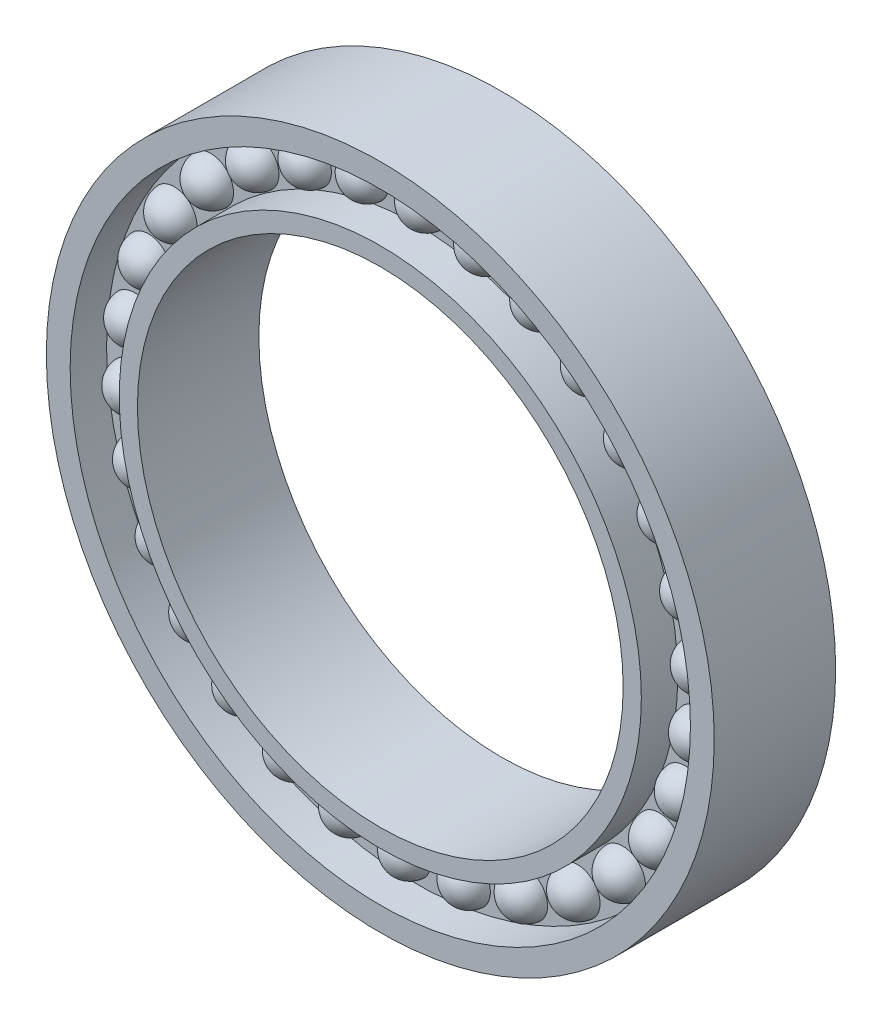
from build123d import *

# Parameters (mm, degrees)
SKETCH_1_R                       = 11
SKETCH_1_R_2                     = 8
EXTRUDE_1_DEPTH                  = 2
SKETCH_2_R                       = 10.215825938
SKETCH_2_R_2                     = 8.598967876
CUT_EXTRUDE_1_DEPTH              = 1.2
SKETCH_4_R                       = 0.75
EXTRUDE_2_DEPTH                  = 1.5
FILLET_1_R                       = 0.75
FILLET_2_R                       = 0.75
PATTERN_CIRCULAR_2_COUNT         = 30
FILLET_1_OF_PATTERN_CIRCULAR_2_R = 0.75
FILLET_2_OF_PATTERN_CIRCULAR_2_R = 0.75


with BuildPart() as part:
    # 草图1 → 凸台-拉伸1 (new, symmetric)
    with BuildSketch(Plane.XY):
        Circle(SKETCH_1_R)
        Circle(SKETCH_1_R_2, mode=Mode.SUBTRACT)
    extrude(amount=EXTRUDE_1_DEPTH, both=True)

    # 草图2 → 切除-拉伸1 (cut)
    with BuildSketch(Plane.XY.offset(2)):
        Circle(SKETCH_2_R)
        Circle(SKETCH_2_R_2, mode=Mode.SUBTRACT)
    cut_extrude_1 = extrude(amount=-CUT_EXTRUDE_1_DEPTH, mode=Mode.SUBTRACT)

    # 镜向1: 切除-拉伸1 across plane
    add(cut_extrude_1.mirror(Plane.XY), mode=Mode.SUBTRACT)

    # 草图4 → 凸台-拉伸2 (add, symmetric)
    with BuildSketch(Plane.XY):
        with Locations(Location((0.280832933, 9.38335006, 0), (0, 0, 180))):
            Circle(SKETCH_4_R)
    extrude_2 = extrude(amount=EXTRUDE_2_DEPTH, both=True)

    # 圆角1
    # the kernel refuses this fillet: 0.75 mm, written as the material it takes off along each edge
    with BuildSketch(Plane(origin=(0.280832933, 9.38335006, 1.5), x_dir=(-1, 0, 0), z_dir=(0, 1, 0))) as fillet_1_piece_1:
        with BuildLine():
            CenterArc((0.001668523, -0.75), FILLET_1_R, 3.822553729, 86.177446271)
            Line((0.001668523, 0), (0.001668523, 0.015))
            Line((0.001668523, 0.015), (0.75, 0.015))
            Line((0.75, 0.015), (0.765, 0))
            ThreePointArc((0.765, 0), (0.765, -0.35), (0.76496663, -0.699))
            Line((0.76496663, -0.699), (0.75, -0.7))
        make_face()
    revolve(axis=Axis((0.280832933, 9.38335006, 1.5), (0, 0, 1)), mode=Mode.SUBTRACT)

    # 圆角2
    # the kernel refuses this fillet: 0.75 mm, written as the material it takes off along each edge
    with BuildSketch(Plane(origin=(0.280832933, 9.38335006, -1.5), x_dir=(-1, 0, 0), z_dir=(0, 1, 0))) as fillet_2_piece_1:
        with BuildLine():
            CenterArc((0.001668523, 0.75), FILLET_2_R, 270, 86.177446271)
            Line((0.001668523, 0), (0.001668523, -0.015))
            Line((0.001668523, -0.015), (0.75, -0.015))
            Line((0.75, -0.015), (0.765, 0))
            ThreePointArc((0.765, 0), (0.765, 0.35), (0.76496663, 0.699))
            Line((0.76496663, 0.699), (0.75, 0.7))
        make_face()
    revolve(axis=Axis((0.280832933, 9.38335006, -1.5), (0, 0, 1)), mode=Mode.SUBTRACT)

    # 阵列(圆周)2: 凸台-拉伸2 ×30 about axis
    pattern_circular_2_axis = Axis((0, 0, 0), (0, 0, 1))
    for i in range(1, PATTERN_CIRCULAR_2_COUNT):
        add(extrude_2.rotate(pattern_circular_2_axis, i * 360 / PATTERN_CIRCULAR_2_COUNT))

    # 圆角1 of 阵列(圆周)2
    # the kernel refuses this fillet: 0.75 mm, written as the material it takes off along each edge
    with BuildSketch(Plane(origin=(-1.676212117, 9.236689798, 1.5), x_dir=(-0.9781476007338056, -0.2079116908177596, 0), z_dir=(-0.2079116908177596, 0.9781476007338056, 0))) as fillet_1_of_pattern_circular_2_piece_1:
        with BuildLine():
            CenterArc((0.001668523, -0.75), FILLET_1_OF_PATTERN_CIRCULAR_2_R, 3.822553729, 86.177446271)
            Line((0.001668523, 0), (0.001668523, 0.015))
            Line((0.001668523, 0.015), (0.75, 0.015))
            Line((0.75, 0.015), (0.765, 0))
            ThreePointArc((0.765, 0), (0.765, -0.35), (0.76496663, -0.699))
            Line((0.76496663, -0.699), (0.75, -0.7))
        make_face()
    revolve(axis=Axis((-1.676212117, 9.236689798, 1.5), (0, 0, 1)), mode=Mode.SUBTRACT)
    with BuildSketch(Plane(origin=(-3.559998654, 8.68634187, 1.5), x_dir=(-0.9135454576426008, -0.4067366430758004, 0), z_dir=(-0.4067366430758004, 0.9135454576426008, 0))) as fillet_1_of_pattern_circular_2_piece_2:
        with BuildLine():
            CenterArc((0.001668523, -0.75), FILLET_1_OF_PATTERN_CIRCULAR_2_R, 3.822553729, 86.177446271)
            Line((0.001668523, 0), (0.001668523, 0.015))
            Line((0.001668523, 0.015), (0.75, 0.015))
            Line((0.75, 0.015), (0.765, 0))
            ThreePointArc((0.765, 0), (0.765, -0.35), (0.76496663, -0.699))
            Line((0.76496663, -0.699), (0.75, -0.7))
        make_face()
    revolve(axis=Axis((-3.559998654, 8.68634187, 1.5), (0, 0, 1)), mode=Mode.SUBTRACT)
    with BuildSketch(Plane(origin=(-5.288196167, 7.75635912, 1.5), x_dir=(-0.8090169943749473, -0.5877852522924731, 0), z_dir=(-0.5877852522924731, 0.8090169943749473, 0))) as fillet_1_of_pattern_circular_2_piece_3:
        with BuildLine():
            CenterArc((0.001668523, -0.75), FILLET_1_OF_PATTERN_CIRCULAR_2_R, 3.822553729, 86.177446271)
            Line((0.001668523, 0), (0.001668523, 0.015))
            Line((0.001668523, 0.015), (0.75, 0.015))
            Line((0.75, 0.015), (0.765, 0))
            ThreePointArc((0.765, 0), (0.765, -0.35), (0.76496663, -0.699))
            Line((0.76496663, -0.699), (0.75, -0.7))
        make_face()
    revolve(axis=Axis((-5.288196167, 7.75635912, 1.5), (0, 0, 1)), mode=Mode.SUBTRACT)
    with BuildSketch(Plane(origin=(-6.785274132, 6.487386257, 1.5), x_dir=(-0.6691306063588576, -0.7431448254773948, 0), z_dir=(-0.7431448254773948, 0.6691306063588576, 0))) as fillet_1_of_pattern_circular_2_piece_4:
        with BuildLine():
            CenterArc((0.001668523, -0.75), FILLET_1_OF_PATTERN_CIRCULAR_2_R, 3.822553729, 86.177446271)
            Line((0.001668523, 0), (0.001668523, 0.015))
            Line((0.001668523, 0.015), (0.75, 0.015))
            Line((0.75, 0.015), (0.765, 0))
            ThreePointArc((0.765, 0), (0.765, -0.35), (0.76496663, -0.699))
            Line((0.76496663, -0.699), (0.75, -0.7))
        make_face()
    revolve(axis=Axis((-6.785274132, 6.487386257, 1.5), (0, 0, 1)), mode=Mode.SUBTRACT)
    with BuildSketch(Plane(origin=(-7.985803058, 4.934883485, 1.5), x_dir=(-0.4999999999999991, -0.8660254037844392, 0), z_dir=(-0.8660254037844392, 0.4999999999999991, 0))) as fillet_1_of_pattern_circular_2_piece_5:
        with BuildLine():
            CenterArc((0.001668523, -0.75), FILLET_1_OF_PATTERN_CIRCULAR_2_R, 3.822553729, 86.177446271)
            Line((0.001668523, 0), (0.001668523, 0.015))
            Line((0.001668523, 0.015), (0.75, 0.015))
            Line((0.75, 0.015), (0.765, 0))
            ThreePointArc((0.765, 0), (0.765, -0.35), (0.76496663, -0.699))
            Line((0.76496663, -0.699), (0.75, -0.7))
        make_face()
    revolve(axis=Axis((-7.985803058, 4.934883485, 1.5), (0, 0, 1)), mode=Mode.SUBTRACT)
    with BuildSketch(Plane(origin=(-8.837314071, 3.166702624, 1.5), x_dir=(-0.3090169943749475, -0.9510565162951535, 0), z_dir=(-0.9510565162951535, 0.3090169943749475, 0))) as fillet_1_of_pattern_circular_2_piece_6:
        with BuildLine():
            CenterArc((0.001668523, -0.75), FILLET_1_OF_PATTERN_CIRCULAR_2_R, 3.822553729, 86.177446271)
            Line((0.001668523, 0), (0.001668523, 0.015))
            Line((0.001668523, 0.015), (0.75, 0.015))
            Line((0.75, 0.015), (0.765, 0))
            ThreePointArc((0.765, 0), (0.765, -0.35), (0.76496663, -0.699))
            Line((0.76496663, -0.699), (0.75, -0.7))
        make_face()
    revolve(axis=Axis((-8.837314071, 3.166702624, 1.5), (0, 0, 1)), mode=Mode.SUBTRACT)
    with BuildSketch(Plane(origin=(-9.302592052, 1.260121663, 1.5), x_dir=(-0.10452846326765315, -0.9945218953682734, 0), z_dir=(-0.9945218953682734, 0.10452846326765315, 0))) as fillet_1_of_pattern_circular_2_piece_7:
        with BuildLine():
            CenterArc((0.001668523, -0.75), FILLET_1_OF_PATTERN_CIRCULAR_2_R, 3.822553729, 86.177446271)
            Line((0.001668523, 0), (0.001668523, 0.015))
            Line((0.001668523, 0.015), (0.75, 0.015))
            Line((0.75, 0.015), (0.765, 0))
            ThreePointArc((0.765, 0), (0.765, -0.35), (0.76496663, -0.699))
            Line((0.76496663, -0.699), (0.75, -0.7))
        make_face()
    revolve(axis=Axis((-9.302592052, 1.260121663, 1.5), (0, 0, 1)), mode=Mode.SUBTRACT)
    with BuildSketch(Plane(origin=(-9.361302122, -0.701532661, 1.5), x_dir=(0.10452846326765314, -0.9945218953682734, 0), z_dir=(-0.9945218953682734, -0.10452846326765314, 0))) as fillet_1_of_pattern_circular_2_piece_8:
        with BuildLine():
            CenterArc((0.001668523, -0.75), FILLET_1_OF_PATTERN_CIRCULAR_2_R, 3.822553729, 86.177446271)
            Line((0.001668523, 0), (0.001668523, 0.015))
            Line((0.001668523, 0.015), (0.75, 0.015))
            Line((0.75, 0.015), (0.765, 0))
            ThreePointArc((0.765, 0), (0.765, -0.35), (0.76496663, -0.699))
            Line((0.76496663, -0.699), (0.75, -0.7))
        make_face()
    revolve(axis=Axis((-9.361302122, -0.701532661, 1.5), (0, 0, 1)), mode=Mode.SUBTRACT)
    with BuildSketch(Plane(origin=(-9.010878369, -2.632526642, 1.5), x_dir=(0.3090169943749475, -0.9510565162951535, 0), z_dir=(-0.9510565162951535, -0.3090169943749475, 0))) as fillet_1_of_pattern_circular_2_piece_9:
        with BuildLine():
            CenterArc((0.001668523, -0.75), FILLET_1_OF_PATTERN_CIRCULAR_2_R, 3.822553729, 86.177446271)
            Line((0.001668523, 0), (0.001668523, 0.015))
            Line((0.001668523, 0.015), (0.75, 0.015))
            Line((0.75, 0.015), (0.765, 0))
            ThreePointArc((0.765, 0), (0.765, -0.35), (0.76496663, -0.699))
            Line((0.76496663, -0.699), (0.75, -0.7))
        make_face()
    revolve(axis=Axis((-9.010878369, -2.632526642, 1.5), (0, 0, 1)), mode=Mode.SUBTRACT)
    with BuildSketch(Plane(origin=(-8.266635992, -4.448466576, 1.5), x_dir=(0.5, -0.8660254037844387, 0), z_dir=(-0.8660254037844387, -0.5, 0))) as fillet_1_of_pattern_circular_2_piece_10:
        with BuildLine():
            CenterArc((0.001668523, -0.75), FILLET_1_OF_PATTERN_CIRCULAR_2_R, 3.822553729, 86.177446271)
            Line((0.001668523, 0), (0.001668523, 0.015))
            Line((0.001668523, 0.015), (0.75, 0.015))
            Line((0.75, 0.015), (0.765, 0))
            ThreePointArc((0.765, 0), (0.765, -0.35), (0.76496663, -0.699))
            Line((0.76496663, -0.699), (0.75, -0.7))
        make_face()
    revolve(axis=Axis((-8.266635992, -4.448466576, 1.5), (0, 0, 1)), mode=Mode.SUBTRACT)
    with BuildSketch(Plane(origin=(-7.161101954, -6.069987174, 1.5), x_dir=(0.6691306063588576, -0.7431448254773948, 0), z_dir=(-0.7431448254773948, -0.6691306063588576, 0))) as fillet_1_of_pattern_circular_2_piece_11:
        with BuildLine():
            CenterArc((0.001668523, -0.75), FILLET_1_OF_PATTERN_CIRCULAR_2_R, 3.822553729, 86.177446271)
            Line((0.001668523, 0), (0.001668523, 0.015))
            Line((0.001668523, 0.015), (0.75, 0.015))
            Line((0.75, 0.015), (0.765, 0))
            ThreePointArc((0.765, 0), (0.765, -0.35), (0.76496663, -0.699))
            Line((0.76496663, -0.699), (0.75, -0.7))
        make_face()
    revolve(axis=Axis((-7.161101954, -6.069987174, 1.5), (0, 0, 1)), mode=Mode.SUBTRACT)
    with BuildSketch(Plane(origin=(-5.742593398, -7.426220206, 1.5), x_dir=(0.8090169943749473, -0.5877852522924731, 0), z_dir=(-0.5877852522924731, -0.8090169943749473, 0))) as fillet_1_of_pattern_circular_2_piece_12:
        with BuildLine():
            CenterArc((0.001668523, -0.75), FILLET_1_OF_PATTERN_CIRCULAR_2_R, 3.822553729, 86.177446271)
            Line((0.001668523, 0), (0.001668523, 0.015))
            Line((0.001668523, 0.015), (0.75, 0.015))
            Line((0.75, 0.015), (0.765, 0))
            ThreePointArc((0.765, 0), (0.765, -0.35), (0.76496663, -0.699))
            Line((0.76496663, -0.699), (0.75, -0.7))
        make_face()
    revolve(axis=Axis((-5.742593398, -7.426220206, 1.5), (0, 0, 1)), mode=Mode.SUBTRACT)
    with BuildSketch(Plane(origin=(-4.073105955, -8.457891781, 1.5), x_dir=(0.9135454576426008, -0.40673664307580065, 0), z_dir=(-0.40673664307580065, -0.9135454576426008, 0))) as fillet_1_of_pattern_circular_2_piece_13:
        with BuildLine():
            CenterArc((0.001668523, -0.75), FILLET_1_OF_PATTERN_CIRCULAR_2_R, 3.822553729, 86.177446271)
            Line((0.001668523, 0), (0.001668523, 0.015))
            Line((0.001668523, 0.015), (0.75, 0.015))
            Line((0.75, 0.015), (0.765, 0))
            ThreePointArc((0.765, 0), (0.765, -0.35), (0.76496663, -0.699))
            Line((0.76496663, -0.699), (0.75, -0.7))
        make_face()
    revolve(axis=Axis((-4.073105955, -8.457891781, 1.5), (0, 0, 1)), mode=Mode.SUBTRACT)
    with BuildSketch(Plane(origin=(-2.225604236, -9.119912898, 1.5), x_dir=(0.9781476007338056, -0.20791169081775945, 0), z_dir=(-0.20791169081775945, -0.9781476007338056, 0))) as fillet_1_of_pattern_circular_2_piece_14:
        with BuildLine():
            CenterArc((0.001668523, -0.75), FILLET_1_OF_PATTERN_CIRCULAR_2_R, 3.822553729, 86.177446271)
            Line((0.001668523, 0), (0.001668523, 0.015))
            Line((0.001668523, 0.015), (0.75, 0.015))
            Line((0.75, 0.015), (0.765, 0))
            ThreePointArc((0.765, 0), (0.765, -0.35), (0.76496663, -0.699))
            Line((0.76496663, -0.699), (0.75, -0.7))
        make_face()
    revolve(axis=Axis((-2.225604236, -9.119912898, 1.5), (0, 0, 1)), mode=Mode.SUBTRACT)
    with BuildSketch(Plane(origin=(-0.280832933, -9.38335006, 1.5), x_dir=(1, 0, 0), z_dir=(0, -1, 0))) as fillet_1_of_pattern_circular_2_piece_15:
        with BuildLine():
            CenterArc((0.001668523, -0.75), FILLET_1_OF_PATTERN_CIRCULAR_2_R, 3.822553729, 86.177446271)
            Line((0.001668523, 0), (0.001668523, 0.015))
            Line((0.001668523, 0.015), (0.75, 0.015))
            Line((0.75, 0.015), (0.765, 0))
            ThreePointArc((0.765, 0), (0.765, -0.35), (0.76496663, -0.699))
            Line((0.76496663, -0.699), (0.75, -0.7))
        make_face()
    revolve(axis=Axis((-0.280832933, -9.38335006, 1.5), (0, 0, 1)), mode=Mode.SUBTRACT)
    with BuildSketch(Plane(origin=(1.676212117, -9.236689798, 1.5), x_dir=(0.9781476007338056, 0.2079116908177596, 0), z_dir=(0.2079116908177596, -0.9781476007338056, 0))) as fillet_1_of_pattern_circular_2_piece_16:
        with BuildLine():
            CenterArc((0.001668523, -0.75), FILLET_1_OF_PATTERN_CIRCULAR_2_R, 3.822553729, 86.177446271)
            Line((0.001668523, 0), (0.001668523, 0.015))
            Line((0.001668523, 0.015), (0.75, 0.015))
            Line((0.75, 0.015), (0.765, 0))
            ThreePointArc((0.765, 0), (0.765, -0.35), (0.76496663, -0.699))
            Line((0.76496663, -0.699), (0.75, -0.7))
        make_face()
    revolve(axis=Axis((1.676212117, -9.236689798, 1.5), (0, 0, 1)), mode=Mode.SUBTRACT)
    with BuildSketch(Plane(origin=(3.559998654, -8.68634187, 1.5), x_dir=(0.9135454576426008, 0.4067366430758004, 0), z_dir=(0.4067366430758004, -0.9135454576426008, 0))) as fillet_1_of_pattern_circular_2_piece_17:
        with BuildLine():
            CenterArc((0.001668523, -0.75), FILLET_1_OF_PATTERN_CIRCULAR_2_R, 3.822553729, 86.177446271)
            Line((0.001668523, 0), (0.001668523, 0.015))
            Line((0.001668523, 0.015), (0.75, 0.015))
            Line((0.75, 0.015), (0.765, 0))
            ThreePointArc((0.765, 0), (0.765, -0.35), (0.76496663, -0.699))
            Line((0.76496663, -0.699), (0.75, -0.7))
        make_face()
    revolve(axis=Axis((3.559998654, -8.68634187, 1.5), (0, 0, 1)), mode=Mode.SUBTRACT)
    with BuildSketch(Plane(origin=(5.288196167, -7.75635912, 1.5), x_dir=(0.8090169943749473, 0.5877852522924731, 0), z_dir=(0.5877852522924731, -0.8090169943749473, 0))) as fillet_1_of_pattern_circular_2_piece_18:
        with BuildLine():
            CenterArc((0.001668523, -0.75), FILLET_1_OF_PATTERN_CIRCULAR_2_R, 3.822553729, 86.177446271)
            Line((0.001668523, 0), (0.001668523, 0.015))
            Line((0.001668523, 0.015), (0.75, 0.015))
            Line((0.75, 0.015), (0.765, 0))
            ThreePointArc((0.765, 0), (0.765, -0.35), (0.76496663, -0.699))
            Line((0.76496663, -0.699), (0.75, -0.7))
        make_face()
    revolve(axis=Axis((5.288196167, -7.75635912, 1.5), (0, 0, 1)), mode=Mode.SUBTRACT)
    with BuildSketch(Plane(origin=(6.785274132, -6.487386257, 1.5), x_dir=(0.6691306063588576, 0.7431448254773948, 0), z_dir=(0.7431448254773948, -0.6691306063588576, 0))) as fillet_1_of_pattern_circular_2_piece_19:
        with BuildLine():
            CenterArc((0.001668523, -0.75), FILLET_1_OF_PATTERN_CIRCULAR_2_R, 3.822553729, 86.177446271)
            Line((0.001668523, 0), (0.001668523, 0.015))
            Line((0.001668523, 0.015), (0.75, 0.015))
            Line((0.75, 0.015), (0.765, 0))
            ThreePointArc((0.765, 0), (0.765, -0.35), (0.76496663, -0.699))
            Line((0.76496663, -0.699), (0.75, -0.7))
        make_face()
    revolve(axis=Axis((6.785274132, -6.487386257, 1.5), (0, 0, 1)), mode=Mode.SUBTRACT)
    with BuildSketch(Plane(origin=(7.985803058, -4.934883485, 1.5), x_dir=(0.5, 0.8660254037844387, 0), z_dir=(0.8660254037844387, -0.5, 0))) as fillet_1_of_pattern_circular_2_piece_20:
        with BuildLine():
            CenterArc((0.001668523, -0.75), FILLET_1_OF_PATTERN_CIRCULAR_2_R, 3.822553729, 86.177446271)
            Line((0.001668523, 0), (0.001668523, 0.015))
            Line((0.001668523, 0.015), (0.75, 0.015))
            Line((0.75, 0.015), (0.765, 0))
            ThreePointArc((0.765, 0), (0.765, -0.35), (0.76496663, -0.699))
            Line((0.76496663, -0.699), (0.75, -0.7))
        make_face()
    revolve(axis=Axis((7.985803058, -4.934883485, 1.5), (0, 0, 1)), mode=Mode.SUBTRACT)
    with BuildSketch(Plane(origin=(8.837314071, -3.166702624, 1.5), x_dir=(0.3090169943749475, 0.9510565162951535, 0), z_dir=(0.9510565162951535, -0.3090169943749475, 0))) as fillet_1_of_pattern_circular_2_piece_21:
        with BuildLine():
            CenterArc((0.001668523, -0.75), FILLET_1_OF_PATTERN_CIRCULAR_2_R, 3.822553729, 86.177446271)
            Line((0.001668523, 0), (0.001668523, 0.015))
            Line((0.001668523, 0.015), (0.75, 0.015))
            Line((0.75, 0.015), (0.765, 0))
            ThreePointArc((0.765, 0), (0.765, -0.35), (0.76496663, -0.699))
            Line((0.76496663, -0.699), (0.75, -0.7))
        make_face()
    revolve(axis=Axis((8.837314071, -3.166702624, 1.5), (0, 0, 1)), mode=Mode.SUBTRACT)
    with BuildSketch(Plane(origin=(9.302592052, -1.260121663, 1.5), x_dir=(0.10452846326765314, 0.9945218953682734, 0), z_dir=(0.9945218953682734, -0.10452846326765314, 0))) as fillet_1_of_pattern_circular_2_piece_22:
        with BuildLine():
            CenterArc((0.001668523, -0.75), FILLET_1_OF_PATTERN_CIRCULAR_2_R, 3.822553729, 86.177446271)
            Line((0.001668523, 0), (0.001668523, 0.015))
            Line((0.001668523, 0.015), (0.75, 0.015))
            Line((0.75, 0.015), (0.765, 0))
            ThreePointArc((0.765, 0), (0.765, -0.35), (0.76496663, -0.699))
            Line((0.76496663, -0.699), (0.75, -0.7))
        make_face()
    revolve(axis=Axis((9.302592052, -1.260121663, 1.5), (0, 0, 1)), mode=Mode.SUBTRACT)
    with BuildSketch(Plane(origin=(9.361302122, 0.701532661, 1.5), x_dir=(-0.10452846326765314, 0.9945218953682734, 0), z_dir=(0.9945218953682734, 0.10452846326765314, 0))) as fillet_1_of_pattern_circular_2_piece_23:
        with BuildLine():
            CenterArc((0.001668523, -0.75), FILLET_1_OF_PATTERN_CIRCULAR_2_R, 3.822553729, 86.177446271)
            Line((0.001668523, 0), (0.001668523, 0.015))
            Line((0.001668523, 0.015), (0.75, 0.015))
            Line((0.75, 0.015), (0.765, 0))
            ThreePointArc((0.765, 0), (0.765, -0.35), (0.76496663, -0.699))
            Line((0.76496663, -0.699), (0.75, -0.7))
        make_face()
    revolve(axis=Axis((9.361302122, 0.701532661, 1.5), (0, 0, 1)), mode=Mode.SUBTRACT)
    with BuildSketch(Plane(origin=(9.010878369, 2.632526642, 1.5), x_dir=(-0.3090169943749475, 0.9510565162951535, 0), z_dir=(0.9510565162951535, 0.3090169943749475, 0))) as fillet_1_of_pattern_circular_2_piece_24:
        with BuildLine():
            CenterArc((0.001668523, -0.75), FILLET_1_OF_PATTERN_CIRCULAR_2_R, 3.822553729, 86.177446271)
            Line((0.001668523, 0), (0.001668523, 0.015))
            Line((0.001668523, 0.015), (0.75, 0.015))
            Line((0.75, 0.015), (0.765, 0))
            ThreePointArc((0.765, 0), (0.765, -0.35), (0.76496663, -0.699))
            Line((0.76496663, -0.699), (0.75, -0.7))
        make_face()
    revolve(axis=Axis((9.010878369, 2.632526642, 1.5), (0, 0, 1)), mode=Mode.SUBTRACT)
    with BuildSketch(Plane(origin=(8.266635992, 4.448466576, 1.5), x_dir=(-0.5000000000000009, 0.8660254037844382, 0), z_dir=(0.8660254037844382, 0.5000000000000009, 0))) as fillet_1_of_pattern_circular_2_piece_25:
        with BuildLine():
            CenterArc((0.001668523, -0.75), FILLET_1_OF_PATTERN_CIRCULAR_2_R, 3.822553729, 86.177446271)
            Line((0.001668523, 0), (0.001668523, 0.015))
            Line((0.001668523, 0.015), (0.75, 0.015))
            Line((0.75, 0.015), (0.765, 0))
            ThreePointArc((0.765, 0), (0.765, -0.35), (0.76496663, -0.699))
            Line((0.76496663, -0.699), (0.75, -0.7))
        make_face()
    revolve(axis=Axis((8.266635992, 4.448466576, 1.5), (0, 0, 1)), mode=Mode.SUBTRACT)
    with BuildSketch(Plane(origin=(7.161101954, 6.069987174, 1.5), x_dir=(-0.6691306063588576, 0.7431448254773948, 0), z_dir=(0.7431448254773948, 0.6691306063588576, 0))) as fillet_1_of_pattern_circular_2_piece_26:
        with BuildLine():
            CenterArc((0.001668523, -0.75), FILLET_1_OF_PATTERN_CIRCULAR_2_R, 3.822553729, 86.177446271)
            Line((0.001668523, 0), (0.001668523, 0.015))
            Line((0.001668523, 0.015), (0.75, 0.015))
            Line((0.75, 0.015), (0.765, 0))
            ThreePointArc((0.765, 0), (0.765, -0.35), (0.76496663, -0.699))
            Line((0.76496663, -0.699), (0.75, -0.7))
        make_face()
    revolve(axis=Axis((7.161101954, 6.069987174, 1.5), (0, 0, 1)), mode=Mode.SUBTRACT)
    with BuildSketch(Plane(origin=(5.742593398, 7.426220206, 1.5), x_dir=(-0.8090169943749473, 0.5877852522924731, 0), z_dir=(0.5877852522924731, 0.8090169943749473, 0))) as fillet_1_of_pattern_circular_2_piece_27:
        with BuildLine():
            CenterArc((0.001668523, -0.75), FILLET_1_OF_PATTERN_CIRCULAR_2_R, 3.822553729, 86.177446271)
            Line((0.001668523, 0), (0.001668523, 0.015))
            Line((0.001668523, 0.015), (0.75, 0.015))
            Line((0.75, 0.015), (0.765, 0))
            ThreePointArc((0.765, 0), (0.765, -0.35), (0.76496663, -0.699))
            Line((0.76496663, -0.699), (0.75, -0.7))
        make_face()
    revolve(axis=Axis((5.742593398, 7.426220206, 1.5), (0, 0, 1)), mode=Mode.SUBTRACT)
    with BuildSketch(Plane(origin=(4.073105955, 8.457891781, 1.5), x_dir=(-0.913545457642601, 0.4067366430758002, 0), z_dir=(0.4067366430758002, 0.913545457642601, 0))) as fillet_1_of_pattern_circular_2_piece_28:
        with BuildLine():
            CenterArc((0.001668523, -0.75), FILLET_1_OF_PATTERN_CIRCULAR_2_R, 3.822553729, 86.177446271)
            Line((0.001668523, 0), (0.001668523, 0.015))
            Line((0.001668523, 0.015), (0.75, 0.015))
            Line((0.75, 0.015), (0.765, 0))
            ThreePointArc((0.765, 0), (0.765, -0.35), (0.76496663, -0.699))
            Line((0.76496663, -0.699), (0.75, -0.7))
        make_face()
    revolve(axis=Axis((4.073105955, 8.457891781, 1.5), (0, 0, 1)), mode=Mode.SUBTRACT)
    with BuildSketch(Plane(origin=(2.225604236, 9.119912898, 1.5), x_dir=(-0.9781476007338056, 0.20791169081775954, 0), z_dir=(0.20791169081775954, 0.9781476007338056, 0))) as fillet_1_of_pattern_circular_2_piece_29:
        with BuildLine():
            CenterArc((0.001668523, -0.75), FILLET_1_OF_PATTERN_CIRCULAR_2_R, 3.822553729, 86.177446271)
            Line((0.001668523, 0), (0.001668523, 0.015))
            Line((0.001668523, 0.015), (0.75, 0.015))
            Line((0.75, 0.015), (0.765, 0))
            ThreePointArc((0.765, 0), (0.765, -0.35), (0.76496663, -0.699))
            Line((0.76496663, -0.699), (0.75, -0.7))
        make_face()
    revolve(axis=Axis((2.225604236, 9.119912898, 1.5), (0, 0, 1)), mode=Mode.SUBTRACT)

    # 圆角2 of 阵列(圆周)2
    # the kernel refuses this fillet: 0.75 mm, written as the material it takes off along each edge
    with BuildSketch(Plane(origin=(-1.676212117, 9.236689798, -1.5), x_dir=(-0.9781476007338056, -0.2079116908177596, 0), z_dir=(-0.2079116908177596, 0.9781476007338056, 0))) as fillet_2_of_pattern_circular_2_piece_1:
        with BuildLine():
            CenterArc((0.001668523, 0.75), FILLET_2_OF_PATTERN_CIRCULAR_2_R, 270, 86.177446271)
            Line((0.001668523, 0), (0.001668523, -0.015))
            Line((0.001668523, -0.015), (0.75, -0.015))
            Line((0.75, -0.015), (0.765, 0))
            ThreePointArc((0.765, 0), (0.765, 0.35), (0.76496663, 0.699))
            Line((0.76496663, 0.699), (0.75, 0.7))
        make_face()
    revolve(axis=Axis((-1.676212117, 9.236689798, -1.5), (0, 0, 1)), mode=Mode.SUBTRACT)
    with BuildSketch(Plane(origin=(-3.559998654, 8.68634187, -1.5), x_dir=(-0.9135454576426008, -0.4067366430758004, 0), z_dir=(-0.4067366430758004, 0.9135454576426008, 0))) as fillet_2_of_pattern_circular_2_piece_2:
        with BuildLine():
            CenterArc((0.001668523, 0.75), FILLET_2_OF_PATTERN_CIRCULAR_2_R, 270, 86.177446271)
            Line((0.001668523, 0), (0.001668523, -0.015))
            Line((0.001668523, -0.015), (0.75, -0.015))
            Line((0.75, -0.015), (0.765, 0))
            ThreePointArc((0.765, 0), (0.765, 0.35), (0.76496663, 0.699))
            Line((0.76496663, 0.699), (0.75, 0.7))
        make_face()
    revolve(axis=Axis((-3.559998654, 8.68634187, -1.5), (0, 0, 1)), mode=Mode.SUBTRACT)
    with BuildSketch(Plane(origin=(-5.288196167, 7.75635912, -1.5), x_dir=(-0.8090169943749473, -0.5877852522924731, 0), z_dir=(-0.5877852522924731, 0.8090169943749473, 0))) as fillet_2_of_pattern_circular_2_piece_3:
        with BuildLine():
            CenterArc((0.001668523, 0.75), FILLET_2_OF_PATTERN_CIRCULAR_2_R, 270, 86.177446271)
            Line((0.001668523, 0), (0.001668523, -0.015))
            Line((0.001668523, -0.015), (0.75, -0.015))
            Line((0.75, -0.015), (0.765, 0))
            ThreePointArc((0.765, 0), (0.765, 0.35), (0.76496663, 0.699))
            Line((0.76496663, 0.699), (0.75, 0.7))
        make_face()
    revolve(axis=Axis((-5.288196167, 7.75635912, -1.5), (0, 0, 1)), mode=Mode.SUBTRACT)
    with BuildSketch(Plane(origin=(-6.785274132, 6.487386257, -1.5), x_dir=(-0.6691306063588576, -0.7431448254773948, 0), z_dir=(-0.7431448254773948, 0.6691306063588576, 0))) as fillet_2_of_pattern_circular_2_piece_4:
        with BuildLine():
            CenterArc((0.001668523, 0.75), FILLET_2_OF_PATTERN_CIRCULAR_2_R, 270, 86.177446271)
            Line((0.001668523, 0), (0.001668523, -0.015))
            Line((0.001668523, -0.015), (0.75, -0.015))
            Line((0.75, -0.015), (0.765, 0))
            ThreePointArc((0.765, 0), (0.765, 0.35), (0.76496663, 0.699))
            Line((0.76496663, 0.699), (0.75, 0.7))
        make_face()
    revolve(axis=Axis((-6.785274132, 6.487386257, -1.5), (0, 0, 1)), mode=Mode.SUBTRACT)
    with BuildSketch(Plane(origin=(-7.985803058, 4.934883485, -1.5), x_dir=(-0.4999999999999991, -0.8660254037844392, 0), z_dir=(-0.8660254037844392, 0.4999999999999991, 0))) as fillet_2_of_pattern_circular_2_piece_5:
        with BuildLine():
            CenterArc((0.001668523, 0.75), FILLET_2_OF_PATTERN_CIRCULAR_2_R, 270, 86.177446271)
            Line((0.001668523, 0), (0.001668523, -0.015))
            Line((0.001668523, -0.015), (0.75, -0.015))
            Line((0.75, -0.015), (0.765, 0))
            ThreePointArc((0.765, 0), (0.765, 0.35), (0.76496663, 0.699))
            Line((0.76496663, 0.699), (0.75, 0.7))
        make_face()
    revolve(axis=Axis((-7.985803058, 4.934883485, -1.5), (0, 0, 1)), mode=Mode.SUBTRACT)
    with BuildSketch(Plane(origin=(-8.837314071, 3.166702624, -1.5), x_dir=(-0.3090169943749475, -0.9510565162951535, 0), z_dir=(-0.9510565162951535, 0.3090169943749475, 0))) as fillet_2_of_pattern_circular_2_piece_6:
        with BuildLine():
            CenterArc((0.001668523, 0.75), FILLET_2_OF_PATTERN_CIRCULAR_2_R, 270, 86.177446271)
            Line((0.001668523, 0), (0.001668523, -0.015))
            Line((0.001668523, -0.015), (0.75, -0.015))
            Line((0.75, -0.015), (0.765, 0))
            ThreePointArc((0.765, 0), (0.765, 0.35), (0.76496663, 0.699))
            Line((0.76496663, 0.699), (0.75, 0.7))
        make_face()
    revolve(axis=Axis((-8.837314071, 3.166702624, -1.5), (0, 0, 1)), mode=Mode.SUBTRACT)
    with BuildSketch(Plane(origin=(-9.302592052, 1.260121663, -1.5), x_dir=(-0.10452846326765312, -0.9945218953682734, 0), z_dir=(-0.9945218953682734, 0.10452846326765312, 0))) as fillet_2_of_pattern_circular_2_piece_7:
        with BuildLine():
            CenterArc((0.001668523, 0.75), FILLET_2_OF_PATTERN_CIRCULAR_2_R, 270, 86.177446271)
            Line((0.001668523, 0), (0.001668523, -0.015))
            Line((0.001668523, -0.015), (0.75, -0.015))
            Line((0.75, -0.015), (0.765, 0))
            ThreePointArc((0.765, 0), (0.765, 0.35), (0.76496663, 0.699))
            Line((0.76496663, 0.699), (0.75, 0.7))
        make_face()
    revolve(axis=Axis((-9.302592052, 1.260121663, -1.5), (0, 0, 1)), mode=Mode.SUBTRACT)
    with BuildSketch(Plane(origin=(-9.361302122, -0.701532661, -1.5), x_dir=(0.10452846326765312, -0.9945218953682734, 0), z_dir=(-0.9945218953682734, -0.10452846326765312, 0))) as fillet_2_of_pattern_circular_2_piece_8:
        with BuildLine():
            CenterArc((0.001668523, 0.75), FILLET_2_OF_PATTERN_CIRCULAR_2_R, 270, 86.177446271)
            Line((0.001668523, 0), (0.001668523, -0.015))
            Line((0.001668523, -0.015), (0.75, -0.015))
            Line((0.75, -0.015), (0.765, 0))
            ThreePointArc((0.765, 0), (0.765, 0.35), (0.76496663, 0.699))
            Line((0.76496663, 0.699), (0.75, 0.7))
        make_face()
    revolve(axis=Axis((-9.361302122, -0.701532661, -1.5), (0, 0, 1)), mode=Mode.SUBTRACT)
    with BuildSketch(Plane(origin=(-9.010878369, -2.632526642, -1.5), x_dir=(0.3090169943749475, -0.9510565162951535, 0), z_dir=(-0.9510565162951535, -0.3090169943749475, 0))) as fillet_2_of_pattern_circular_2_piece_9:
        with BuildLine():
            CenterArc((0.001668523, 0.75), FILLET_2_OF_PATTERN_CIRCULAR_2_R, 270, 86.177446271)
            Line((0.001668523, 0), (0.001668523, -0.015))
            Line((0.001668523, -0.015), (0.75, -0.015))
            Line((0.75, -0.015), (0.765, 0))
            ThreePointArc((0.765, 0), (0.765, 0.35), (0.76496663, 0.699))
            Line((0.76496663, 0.699), (0.75, 0.7))
        make_face()
    revolve(axis=Axis((-9.010878369, -2.632526642, -1.5), (0, 0, 1)), mode=Mode.SUBTRACT)
    with BuildSketch(Plane(origin=(-8.266635992, -4.448466576, -1.5), x_dir=(0.5, -0.8660254037844387, 0), z_dir=(-0.8660254037844387, -0.5, 0))) as fillet_2_of_pattern_circular_2_piece_10:
        with BuildLine():
            CenterArc((0.001668523, 0.75), FILLET_2_OF_PATTERN_CIRCULAR_2_R, 270, 86.177446271)
            Line((0.001668523, 0), (0.001668523, -0.015))
            Line((0.001668523, -0.015), (0.75, -0.015))
            Line((0.75, -0.015), (0.765, 0))
            ThreePointArc((0.765, 0), (0.765, 0.35), (0.76496663, 0.699))
            Line((0.76496663, 0.699), (0.75, 0.7))
        make_face()
    revolve(axis=Axis((-8.266635992, -4.448466576, -1.5), (0, 0, 1)), mode=Mode.SUBTRACT)
    with BuildSketch(Plane(origin=(-7.161101954, -6.069987174, -1.5), x_dir=(0.6691306063588576, -0.7431448254773948, 0), z_dir=(-0.7431448254773948, -0.6691306063588576, 0))) as fillet_2_of_pattern_circular_2_piece_11:
        with BuildLine():
            CenterArc((0.001668523, 0.75), FILLET_2_OF_PATTERN_CIRCULAR_2_R, 270, 86.177446271)
            Line((0.001668523, 0), (0.001668523, -0.015))
            Line((0.001668523, -0.015), (0.75, -0.015))
            Line((0.75, -0.015), (0.765, 0))
            ThreePointArc((0.765, 0), (0.765, 0.35), (0.76496663, 0.699))
            Line((0.76496663, 0.699), (0.75, 0.7))
        make_face()
    revolve(axis=Axis((-7.161101954, -6.069987174, -1.5), (0, 0, 1)), mode=Mode.SUBTRACT)
    with BuildSketch(Plane(origin=(-5.742593398, -7.426220206, -1.5), x_dir=(0.8090169943749473, -0.5877852522924731, 0), z_dir=(-0.5877852522924731, -0.8090169943749473, 0))) as fillet_2_of_pattern_circular_2_piece_12:
        with BuildLine():
            CenterArc((0.001668523, 0.75), FILLET_2_OF_PATTERN_CIRCULAR_2_R, 270, 86.177446271)
            Line((0.001668523, 0), (0.001668523, -0.015))
            Line((0.001668523, -0.015), (0.75, -0.015))
            Line((0.75, -0.015), (0.765, 0))
            ThreePointArc((0.765, 0), (0.765, 0.35), (0.76496663, 0.699))
            Line((0.76496663, 0.699), (0.75, 0.7))
        make_face()
    revolve(axis=Axis((-5.742593398, -7.426220206, -1.5), (0, 0, 1)), mode=Mode.SUBTRACT)
    with BuildSketch(Plane(origin=(-4.073105955, -8.457891781, -1.5), x_dir=(0.9135454576426008, -0.40673664307580065, 0), z_dir=(-0.40673664307580065, -0.9135454576426008, 0))) as fillet_2_of_pattern_circular_2_piece_13:
        with BuildLine():
            CenterArc((0.001668523, 0.75), FILLET_2_OF_PATTERN_CIRCULAR_2_R, 270, 86.177446271)
            Line((0.001668523, 0), (0.001668523, -0.015))
            Line((0.001668523, -0.015), (0.75, -0.015))
            Line((0.75, -0.015), (0.765, 0))
            ThreePointArc((0.765, 0), (0.765, 0.35), (0.76496663, 0.699))
            Line((0.76496663, 0.699), (0.75, 0.7))
        make_face()
    revolve(axis=Axis((-4.073105955, -8.457891781, -1.5), (0, 0, 1)), mode=Mode.SUBTRACT)
    with BuildSketch(Plane(origin=(-2.225604236, -9.119912898, -1.5), x_dir=(0.9781476007338056, -0.20791169081775945, 0), z_dir=(-0.20791169081775945, -0.9781476007338056, 0))) as fillet_2_of_pattern_circular_2_piece_14:
        with BuildLine():
            CenterArc((0.001668523, 0.75), FILLET_2_OF_PATTERN_CIRCULAR_2_R, 270, 86.177446271)
            Line((0.001668523, 0), (0.001668523, -0.015))
            Line((0.001668523, -0.015), (0.75, -0.015))
            Line((0.75, -0.015), (0.765, 0))
            ThreePointArc((0.765, 0), (0.765, 0.35), (0.76496663, 0.699))
            Line((0.76496663, 0.699), (0.75, 0.7))
        make_face()
    revolve(axis=Axis((-2.225604236, -9.119912898, -1.5), (0, 0, 1)), mode=Mode.SUBTRACT)
    with BuildSketch(Plane(origin=(-0.280832933, -9.38335006, -1.5), x_dir=(1, 0, 0), z_dir=(0, -1, 0))) as fillet_2_of_pattern_circular_2_piece_15:
        with BuildLine():
            CenterArc((0.001668523, 0.75), FILLET_2_OF_PATTERN_CIRCULAR_2_R, 270, 86.177446271)
            Line((0.001668523, 0), (0.001668523, -0.015))
            Line((0.001668523, -0.015), (0.75, -0.015))
            Line((0.75, -0.015), (0.765, 0))
            ThreePointArc((0.765, 0), (0.765, 0.35), (0.76496663, 0.699))
            Line((0.76496663, 0.699), (0.75, 0.7))
        make_face()
    revolve(axis=Axis((-0.280832933, -9.38335006, -1.5), (0, 0, 1)), mode=Mode.SUBTRACT)
    with BuildSketch(Plane(origin=(1.676212117, -9.236689798, -1.5), x_dir=(0.9781476007338056, 0.2079116908177596, 0), z_dir=(0.2079116908177596, -0.9781476007338056, 0))) as fillet_2_of_pattern_circular_2_piece_16:
        with BuildLine():
            CenterArc((0.001668523, 0.75), FILLET_2_OF_PATTERN_CIRCULAR_2_R, 270, 86.177446271)
            Line((0.001668523, 0), (0.001668523, -0.015))
            Line((0.001668523, -0.015), (0.75, -0.015))
            Line((0.75, -0.015), (0.765, 0))
            ThreePointArc((0.765, 0), (0.765, 0.35), (0.76496663, 0.699))
            Line((0.76496663, 0.699), (0.75, 0.7))
        make_face()
    revolve(axis=Axis((1.676212117, -9.236689798, -1.5), (0, 0, 1)), mode=Mode.SUBTRACT)
    with BuildSketch(Plane(origin=(3.559998654, -8.68634187, -1.5), x_dir=(0.9135454576426008, 0.4067366430758004, 0), z_dir=(0.4067366430758004, -0.9135454576426008, 0))) as fillet_2_of_pattern_circular_2_piece_17:
        with BuildLine():
            CenterArc((0.001668523, 0.75), FILLET_2_OF_PATTERN_CIRCULAR_2_R, 270, 86.177446271)
            Line((0.001668523, 0), (0.001668523, -0.015))
            Line((0.001668523, -0.015), (0.75, -0.015))
            Line((0.75, -0.015), (0.765, 0))
            ThreePointArc((0.765, 0), (0.765, 0.35), (0.76496663, 0.699))
            Line((0.76496663, 0.699), (0.75, 0.7))
        make_face()
    revolve(axis=Axis((3.559998654, -8.68634187, -1.5), (0, 0, 1)), mode=Mode.SUBTRACT)
    with BuildSketch(Plane(origin=(5.288196167, -7.75635912, -1.5), x_dir=(0.8090169943749473, 0.5877852522924731, 0), z_dir=(0.5877852522924731, -0.8090169943749473, 0))) as fillet_2_of_pattern_circular_2_piece_18:
        with BuildLine():
            CenterArc((0.001668523, 0.75), FILLET_2_OF_PATTERN_CIRCULAR_2_R, 270, 86.177446271)
            Line((0.001668523, 0), (0.001668523, -0.015))
            Line((0.001668523, -0.015), (0.75, -0.015))
            Line((0.75, -0.015), (0.765, 0))
            ThreePointArc((0.765, 0), (0.765, 0.35), (0.76496663, 0.699))
            Line((0.76496663, 0.699), (0.75, 0.7))
        make_face()
    revolve(axis=Axis((5.288196167, -7.75635912, -1.5), (0, 0, 1)), mode=Mode.SUBTRACT)
    with BuildSketch(Plane(origin=(6.785274132, -6.487386257, -1.5), x_dir=(0.6691306063588576, 0.7431448254773948, 0), z_dir=(0.7431448254773948, -0.6691306063588576, 0))) as fillet_2_of_pattern_circular_2_piece_19:
        with BuildLine():
            CenterArc((0.001668523, 0.75), FILLET_2_OF_PATTERN_CIRCULAR_2_R, 270, 86.177446271)
            Line((0.001668523, 0), (0.001668523, -0.015))
            Line((0.001668523, -0.015), (0.75, -0.015))
            Line((0.75, -0.015), (0.765, 0))
            ThreePointArc((0.765, 0), (0.765, 0.35), (0.76496663, 0.699))
            Line((0.76496663, 0.699), (0.75, 0.7))
        make_face()
    revolve(axis=Axis((6.785274132, -6.487386257, -1.5), (0, 0, 1)), mode=Mode.SUBTRACT)
    with BuildSketch(Plane(origin=(7.985803058, -4.934883485, -1.5), x_dir=(0.5, 0.8660254037844387, 0), z_dir=(0.8660254037844387, -0.5, 0))) as fillet_2_of_pattern_circular_2_piece_20:
        with BuildLine():
            CenterArc((0.001668523, 0.75), FILLET_2_OF_PATTERN_CIRCULAR_2_R, 270, 86.177446271)
            Line((0.001668523, 0), (0.001668523, -0.015))
            Line((0.001668523, -0.015), (0.75, -0.015))
            Line((0.75, -0.015), (0.765, 0))
            ThreePointArc((0.765, 0), (0.765, 0.35), (0.76496663, 0.699))
            Line((0.76496663, 0.699), (0.75, 0.7))
        make_face()
    revolve(axis=Axis((7.985803058, -4.934883485, -1.5), (0, 0, 1)), mode=Mode.SUBTRACT)
    with BuildSketch(Plane(origin=(8.837314071, -3.166702624, -1.5), x_dir=(0.3090169943749475, 0.9510565162951535, 0), z_dir=(0.9510565162951535, -0.3090169943749475, 0))) as fillet_2_of_pattern_circular_2_piece_21:
        with BuildLine():
            CenterArc((0.001668523, 0.75), FILLET_2_OF_PATTERN_CIRCULAR_2_R, 270, 86.177446271)
            Line((0.001668523, 0), (0.001668523, -0.015))
            Line((0.001668523, -0.015), (0.75, -0.015))
            Line((0.75, -0.015), (0.765, 0))
            ThreePointArc((0.765, 0), (0.765, 0.35), (0.76496663, 0.699))
            Line((0.76496663, 0.699), (0.75, 0.7))
        make_face()
    revolve(axis=Axis((8.837314071, -3.166702624, -1.5), (0, 0, 1)), mode=Mode.SUBTRACT)
    with BuildSketch(Plane(origin=(9.302592052, -1.260121663, -1.5), x_dir=(0.10452846326765314, 0.9945218953682734, 0), z_dir=(0.9945218953682734, -0.10452846326765314, 0))) as fillet_2_of_pattern_circular_2_piece_22:
        with BuildLine():
            CenterArc((0.001668523, 0.75), FILLET_2_OF_PATTERN_CIRCULAR_2_R, 270, 86.177446271)
            Line((0.001668523, 0), (0.001668523, -0.015))
            Line((0.001668523, -0.015), (0.75, -0.015))
            Line((0.75, -0.015), (0.765, 0))
            ThreePointArc((0.765, 0), (0.765, 0.35), (0.76496663, 0.699))
            Line((0.76496663, 0.699), (0.75, 0.7))
        make_face()
    revolve(axis=Axis((9.302592052, -1.260121663, -1.5), (0, 0, 1)), mode=Mode.SUBTRACT)
    with BuildSketch(Plane(origin=(9.361302122, 0.701532661, -1.5), x_dir=(-0.10452846326765314, 0.9945218953682734, 0), z_dir=(0.9945218953682734, 0.10452846326765314, 0))) as fillet_2_of_pattern_circular_2_piece_23:
        with BuildLine():
            CenterArc((0.001668523, 0.75), FILLET_2_OF_PATTERN_CIRCULAR_2_R, 270, 86.177446271)
            Line((0.001668523, 0), (0.001668523, -0.015))
            Line((0.001668523, -0.015), (0.75, -0.015))
            Line((0.75, -0.015), (0.765, 0))
            ThreePointArc((0.765, 0), (0.765, 0.35), (0.76496663, 0.699))
            Line((0.76496663, 0.699), (0.75, 0.7))
        make_face()
    revolve(axis=Axis((9.361302122, 0.701532661, -1.5), (0, 0, 1)), mode=Mode.SUBTRACT)
    with BuildSketch(Plane(origin=(9.010878369, 2.632526642, -1.5), x_dir=(-0.3090169943749475, 0.9510565162951535, 0), z_dir=(0.9510565162951535, 0.3090169943749475, 0))) as fillet_2_of_pattern_circular_2_piece_24:
        with BuildLine():
            CenterArc((0.001668523, 0.75), FILLET_2_OF_PATTERN_CIRCULAR_2_R, 270, 86.177446271)
            Line((0.001668523, 0), (0.001668523, -0.015))
            Line((0.001668523, -0.015), (0.75, -0.015))
            Line((0.75, -0.015), (0.765, 0))
            ThreePointArc((0.765, 0), (0.765, 0.35), (0.76496663, 0.699))
            Line((0.76496663, 0.699), (0.75, 0.7))
        make_face()
    revolve(axis=Axis((9.010878369, 2.632526642, -1.5), (0, 0, 1)), mode=Mode.SUBTRACT)
    with BuildSketch(Plane(origin=(8.266635992, 4.448466576, -1.5), x_dir=(-0.5000000000000009, 0.8660254037844382, 0), z_dir=(0.8660254037844382, 0.5000000000000009, 0))) as fillet_2_of_pattern_circular_2_piece_25:
        with BuildLine():
            CenterArc((0.001668523, 0.75), FILLET_2_OF_PATTERN_CIRCULAR_2_R, 270, 86.177446271)
            Line((0.001668523, 0), (0.001668523, -0.015))
            Line((0.001668523, -0.015), (0.75, -0.015))
            Line((0.75, -0.015), (0.765, 0))
            ThreePointArc((0.765, 0), (0.765, 0.35), (0.76496663, 0.699))
            Line((0.76496663, 0.699), (0.75, 0.7))
        make_face()
    revolve(axis=Axis((8.266635992, 4.448466576, -1.5), (0, 0, 1)), mode=Mode.SUBTRACT)
    with BuildSketch(Plane(origin=(7.161101954, 6.069987174, -1.5), x_dir=(-0.6691306063588576, 0.7431448254773948, 0), z_dir=(0.7431448254773948, 0.6691306063588576, 0))) as fillet_2_of_pattern_circular_2_piece_26:
        with BuildLine():
            CenterArc((0.001668523, 0.75), FILLET_2_OF_PATTERN_CIRCULAR_2_R, 270, 86.177446271)
            Line((0.001668523, 0), (0.001668523, -0.015))
            Line((0.001668523, -0.015), (0.75, -0.015))
            Line((0.75, -0.015), (0.765, 0))
            ThreePointArc((0.765, 0), (0.765, 0.35), (0.76496663, 0.699))
            Line((0.76496663, 0.699), (0.75, 0.7))
        make_face()
    revolve(axis=Axis((7.161101954, 6.069987174, -1.5), (0, 0, 1)), mode=Mode.SUBTRACT)
    with BuildSketch(Plane(origin=(5.742593398, 7.426220206, -1.5), x_dir=(-0.8090169943749473, 0.5877852522924731, 0), z_dir=(0.5877852522924731, 0.8090169943749473, 0))) as fillet_2_of_pattern_circular_2_piece_27:
        with BuildLine():
            CenterArc((0.001668523, 0.75), FILLET_2_OF_PATTERN_CIRCULAR_2_R, 270, 86.177446271)
            Line((0.001668523, 0), (0.001668523, -0.015))
            Line((0.001668523, -0.015), (0.75, -0.015))
            Line((0.75, -0.015), (0.765, 0))
            ThreePointArc((0.765, 0), (0.765, 0.35), (0.76496663, 0.699))
            Line((0.76496663, 0.699), (0.75, 0.7))
        make_face()
    revolve(axis=Axis((5.742593398, 7.426220206, -1.5), (0, 0, 1)), mode=Mode.SUBTRACT)
    with BuildSketch(Plane(origin=(4.073105955, 8.457891781, -1.5), x_dir=(-0.913545457642601, 0.4067366430758002, 0), z_dir=(0.4067366430758002, 0.913545457642601, 0))) as fillet_2_of_pattern_circular_2_piece_28:
        with BuildLine():
            CenterArc((0.001668523, 0.75), FILLET_2_OF_PATTERN_CIRCULAR_2_R, 270, 86.177446271)
            Line((0.001668523, 0), (0.001668523, -0.015))
            Line((0.001668523, -0.015), (0.75, -0.015))
            Line((0.75, -0.015), (0.765, 0))
            ThreePointArc((0.765, 0), (0.765, 0.35), (0.76496663, 0.699))
            Line((0.76496663, 0.699), (0.75, 0.7))
        make_face()
    revolve(axis=Axis((4.073105955, 8.457891781, -1.5), (0, 0, 1)), mode=Mode.SUBTRACT)
    with BuildSketch(Plane(origin=(2.225604236, 9.119912898, -1.5), x_dir=(-0.9781476007338056, 0.20791169081775954, 0), z_dir=(0.20791169081775954, 0.9781476007338056, 0))) as fillet_2_of_pattern_circular_2_piece_29:
        with BuildLine():
            CenterArc((0.001668523, 0.75), FILLET_2_OF_PATTERN_CIRCULAR_2_R, 270, 86.177446271)
            Line((0.001668523, 0), (0.001668523, -0.015))
            Line((0.001668523, -0.015), (0.75, -0.015))
            Line((0.75, -0.015), (0.765, 0))
            ThreePointArc((0.765, 0), (0.765, 0.35), (0.76496663, 0.699))
            Line((0.76496663, 0.699), (0.75, 0.7))
        make_face()
    revolve(axis=Axis((2.225604236, 9.119912898, -1.5), (0, 0, 1)), mode=Mode.SUBTRACT)


solid = part.part
